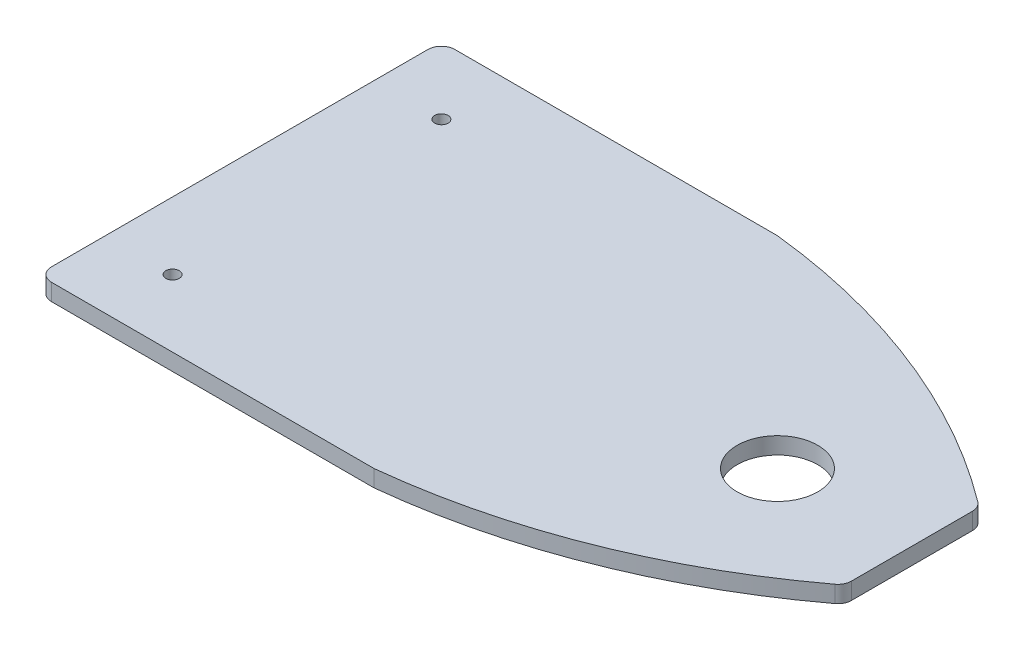
from build123d import *

# Parameters (mm, degrees)
SKETCH1_W           = 127
SKETCH1_H           = 76.2
BOSS_EXTRUDE1_DEPTH = 3.175
CUT_EXTRUDE1_DEPTH  = 3.175
FILLET2_R           = 2.54
FILLET3_R           = 2.54
SKETCH5_R           = 7.62
CUT_EXTRUDE2_DEPTH  = 3.175
SKETCH6_R           = 1.27
CUT_EXTRUDE3_DEPTH  = 3.175


with BuildPart() as part:
    # Sketch1 → Boss-Extrude1 (new body)
    with BuildSketch(Plane(origin=(0, 0, 0), x_dir=(1, 0, 0), z_dir=(0, 1, 0))):
        Rectangle(SKETCH1_W, SKETCH1_H)
    extrude(amount=BOSS_EXTRUDE1_DEPTH)

    # Sketch4 → Cut-Extrude1 (cut)
    with BuildSketch(Plane(origin=(0, 3.175, 0), x_dir=(1, 0, 0), z_dir=(0, 1, 0))):
        with BuildLine():
            Line((0, 38.1), (63.5, 38.1))
            Line((63.5, 38.1), (63.5, 12.7))
            ThreePointArc((63.5, 12.7), (33.491956788, 29.75489197), (0, 38.1))
        make_face()
        with BuildLine():
            Line((63.5, -38.1), (63.5, -12.7))
            ThreePointArc((63.5, -12.7), (33.491956788, -29.75489197), (0, -38.1))
            Line((0, -38.1), (63.5, -38.1))
        make_face()
    extrude(amount=-CUT_EXTRUDE1_DEPTH, mode=Mode.SUBTRACT)

    # Fillet2
    fillet2_edges = [part.edges().sort_by_distance(p)[0] for p in [
        (63.5, 1.5875, 12.7),
        (63.5, 1.5875, -12.7),
    ]]
    fillet(fillet2_edges, radius=FILLET2_R)

    # Fillet3
    fillet3_edges = [part.edges().sort_by_distance(p)[0] for p in [
        (-63.5, 1.5875, 38.1),
        (-63.5, 1.5875, -38.1),
    ]]
    fillet(fillet3_edges, radius=FILLET3_R)

    # Sketch5 → Cut-Extrude2 (cut)
    with BuildSketch(Plane(origin=(0, 3.175, 0), x_dir=(1, 0, 0), z_dir=(0, 1, 0))):
        with Locations((38.1, 0)):
            Circle(SKETCH5_R)
    extrude(amount=-CUT_EXTRUDE2_DEPTH, mode=Mode.SUBTRACT)

    # Sketch6 → Cut-Extrude3 (cut)
    with BuildSketch(Plane(origin=(0, 3.175, 0), x_dir=(1, 0, 0), z_dir=(0, 1, 0))):
        with Locations((-50.8, 25.4)):
            Circle(SKETCH6_R)
        with Locations((-50.8, -25.4)):
            Circle(SKETCH6_R)
    extrude(amount=-CUT_EXTRUDE3_DEPTH, mode=Mode.SUBTRACT)


solid = part.part
